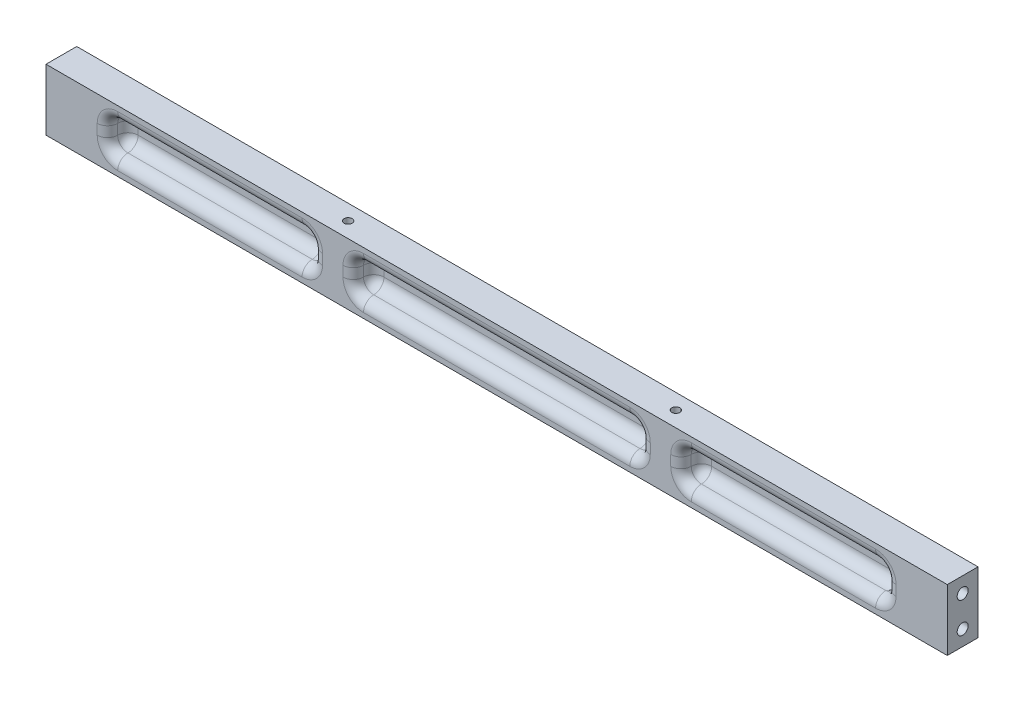
from build123d import *

# Parameters (mm, degrees)
SKETCH1_W                  = 558.8
SKETCH1_H                  = 38.1
EXTRUDE1_DEPTH             = 9.525
M8X1_25_TAPPED_HOLE1_D     = 6.8
M8X1_25_TAPPED_HOLE1_DEPTH = 19.812
M8X1_25_TAPPED_HOLE1_TIP   = 2.042926105
M8X1_25_TAPPED_HOLE2_D     = 6.8
M8X1_25_TAPPED_HOLE2_DEPTH = 19.812
M8X1_25_TAPPED_HOLE2_TIP   = 2.042926105
M6X1_0_TAPPED_HOLE1_D      = 5
M6X1_0_TAPPED_HOLE1_DEPTH  = 12.7
M6X1_0_TAPPED_HOLE1_TIP    = 1.502151548
SKETCH12_W                 = 177.8
SKETCH12_H                 = 19.05
SKETCH12_W_2               = 127
CUT_EXTRUDE1_DEPTH         = 12.7
FILLET1_R                  = 6.35


with BuildPart() as part:
    # Sketch1 → Extrude1 (new, symmetric)
    with BuildSketch(Plane.XY):
        Rectangle(SKETCH1_W, SKETCH1_H)
    extrude(amount=EXTRUDE1_DEPTH, both=True)

    # M8x1.25 Tapped Hole1
    with Locations(Plane.ZY.offset(279.4)):
        with Locations((0, 9.525), (0, -9.525)):
            Hole(M8X1_25_TAPPED_HOLE1_D / 2, depth=M8X1_25_TAPPED_HOLE1_DEPTH)
            with Locations((0, 0, -(M8X1_25_TAPPED_HOLE1_DEPTH + M8X1_25_TAPPED_HOLE1_TIP / 2))):  # 118° drill point
                Cone(0, M8X1_25_TAPPED_HOLE1_D / 2, M8X1_25_TAPPED_HOLE1_TIP, mode=Mode.SUBTRACT)

    # M8x1.25 Tapped Hole2
    with Locations(Plane(origin=(279.4, 0, 0), x_dir=(0, 0, -1), z_dir=(1, 0, 0))):
        with Locations((0, 9.525), (0, -9.525)):
            Hole(M8X1_25_TAPPED_HOLE2_D / 2, depth=M8X1_25_TAPPED_HOLE2_DEPTH)
            with Locations((0, 0, -(M8X1_25_TAPPED_HOLE2_DEPTH + M8X1_25_TAPPED_HOLE2_TIP / 2))):  # 118° drill point
                Cone(0, M8X1_25_TAPPED_HOLE2_D / 2, M8X1_25_TAPPED_HOLE2_TIP, mode=Mode.SUBTRACT)

    # M6x1.0 Tapped Hole1
    with Locations(Plane(origin=(0, 19.05, 0), x_dir=(1, 0, 0), z_dir=(0, 1, 0))):
        with Locations((-101.6, 0), (101.6, 0)):
            Hole(M6X1_0_TAPPED_HOLE1_D / 2, depth=M6X1_0_TAPPED_HOLE1_DEPTH)
            with Locations((0, 0, -(M6X1_0_TAPPED_HOLE1_DEPTH + M6X1_0_TAPPED_HOLE1_TIP / 2))):  # 118° drill point
                Cone(0, M6X1_0_TAPPED_HOLE1_D / 2, M6X1_0_TAPPED_HOLE1_TIP, mode=Mode.SUBTRACT)

    # Sketch12 → Cut-Extrude1 (cut)
    with BuildSketch(Plane.XY.offset(9.525)):
        Rectangle(SKETCH12_W, SKETCH12_H)
        with Locations((177.8, 0)):
            Rectangle(SKETCH12_W_2, SKETCH12_H)
        with Locations((-177.8, 0)):
            Rectangle(SKETCH12_W_2, SKETCH12_H)
    extrude(amount=-CUT_EXTRUDE1_DEPTH, mode=Mode.SUBTRACT)

    # Fillet1
    fillet1_edges = [part.edges().sort_by_distance(p)[0] for p in [
        (-114.3, 0, -3.175),
        (-114.3, 9.525, 3.175),
        (-177.8, -9.525, -3.175),
        (-114.3, -9.525, 3.175),
        (-241.3, 0, -3.175),
        (-241.3, -9.525, 3.175),
        (-177.8, 9.525, -3.175),
        (-241.3, 9.525, 3.175),
        (-114.3, 0, 9.525),
        (-177.8, 9.525, 9.525),
        (-241.3, 0, 9.525),
        (-177.8, -9.525, 9.525),
        (241.3, 9.525, 3.175),
        (177.8, -9.525, -3.175),
        (241.3, -9.525, 3.175),
        (114.3, 0, -3.175),
        (114.3, -9.525, 3.175),
        (177.8, 9.525, -3.175),
        (114.3, 9.525, 3.175),
        (241.3, 0, 9.525),
        (177.8, 9.525, 9.525),
        (114.3, 0, 9.525),
        (177.8, -9.525, 9.525),
        (88.9, 0, -3.175),
        (88.9, 9.525, 3.175),
        (0, -9.525, -3.175),
        (88.9, -9.525, 3.175),
        (-88.9, 0, -3.175),
        (-88.9, -9.525, 3.175),
        (0, 9.525, -3.175),
        (-88.9, 9.525, 3.175),
        (88.9, 0, 9.525),
        (0, 9.525, 9.525),
        (-88.9, 0, 9.525),
        (0, -9.525, 9.525),
    ]]
    fillet(fillet1_edges, radius=FILLET1_R - 0.0001)  # a hair under: the kernel refuses the full size


solid = part.part
